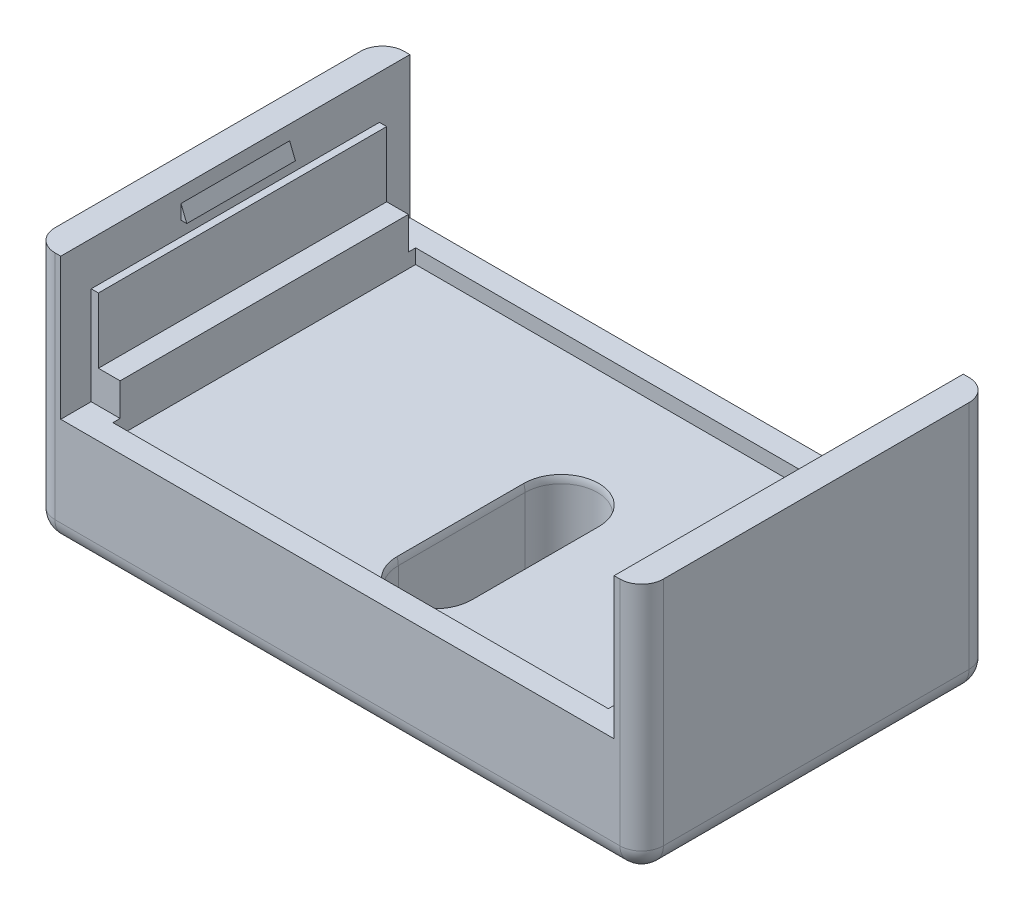
from build123d import *

# Parameters (mm, degrees)
SKETCH2_W               = 84
SKETCH2_H               = 48.2
BOSS_EXTRUDE1_DEPTH     = 3
SKETCH3_W               = 3.8
SKETCH3_H               = 48.2
BOSS_EXTRUDE2_DEPTH     = 19
SKETCH4_W               = 4
SKETCH4_H               = 48.2
BOSS_EXTRUDE3_DEPTH     = 13
BOSS_EXTRUDE4_DEPTH     = 7.5
SKETCH6_W               = 3
SKETCH6_H               = 48.2
CUT_EXTRUDE1_DEPTH      = 9
SKETCH7_W               = 68
SKETCH7_H               = 40.2
CUT_EXTRUDE2_DEPTH      = 0.5
SKETCH9_W               = 84
SKETCH9_H               = 48.2
BOSS_EXTRUDE5_DEPTH     = 15.4
CUT_EXTRUDE3_DEPTH      = 53.202107237
CUT_EXTRUDE3_DEPTH_BACK = 14
CUT_EXTRUDE4_DEPTH      = 53.202107237
CUT_EXTRUDE4_DEPTH_BACK = 53.202107237
FILLET1_R               = 3
SKETCH12_W              = 76.4
SKETCH12_H              = 4.2
CUT_EXTRUDE5_DEPTH      = 20
CUT_EXTRUDE6_DEPTH      = 53.202107283
CUT_EXTRUDE6_DEPTH_BACK = 2
SKETCH13_W              = 68.4
SKETCH13_H              = 41.8


with BuildPart() as part:
    # Sketch2 → Boss-Extrude1 (new body)
    with BuildSketch(Plane(origin=(0, 0, 0), x_dir=(1, 0, 0), z_dir=(0, 1, 0))):
        Rectangle(SKETCH2_W, SKETCH2_H)
    extrude(amount=BOSS_EXTRUDE1_DEPTH)

    # Sketch3 → Boss-Extrude2 (add)
    with BuildSketch(Plane(origin=(0, 3, 0), x_dir=(1, 0, 0), z_dir=(0, 1, 0))):
        with Locations((-40.1, 0)):
            Rectangle(SKETCH3_W, SKETCH3_H)
        with Locations((40.1, 0)):
            Rectangle(SKETCH3_W, SKETCH3_H)
    extrude(amount=BOSS_EXTRUDE2_DEPTH)

    # Sketch4 → Boss-Extrude3 (add)
    with BuildSketch(Plane(origin=(0, 3, 0), x_dir=(1, 0, 0), z_dir=(0, 1, 0))):
        with Locations((-36.2, 0)):
            Rectangle(SKETCH4_W, SKETCH4_H)
        with Locations((36.2, 0)):
            Rectangle(SKETCH4_W, SKETCH4_H)
    extrude(amount=BOSS_EXTRUDE3_DEPTH)

    # Sketch5 → Boss-Extrude4 (add, symmetric)
    with BuildSketch(Plane(origin=(0, 0, 0), x_dir=(-1, 0, 0), z_dir=(0, 0, -1))):
        Polygon((-38.2, 20), (-37.4, 18), (-38.2, 18), align=None)
    boss_extrude4 = extrude(amount=BOSS_EXTRUDE4_DEPTH, both=True)

    # Sketch6 → Cut-Extrude1 (cut)
    with BuildSketch(Plane(origin=(0, 16, 0), x_dir=(1, 0, 0), z_dir=(0, 1, 0))):
        with Locations((35.7, 0)):
            Rectangle(SKETCH6_W, SKETCH6_H)
        with Locations((-35.7, 0)):
            Rectangle(SKETCH6_W, SKETCH6_H)
    extrude(amount=-CUT_EXTRUDE1_DEPTH, mode=Mode.SUBTRACT)

    # Mirror1: Boss-Extrude4 across plane
    add(boss_extrude4.mirror(Plane(origin=(0, 0, 0), x_dir=(0, 0, 1), z_dir=(1, 0, 0))))

    # Sketch7 → Cut-Extrude2 (cut)
    with BuildSketch(Plane(origin=(0, 3, 0), x_dir=(1, 0, 0), z_dir=(0, 1, 0))):
        Rectangle(SKETCH7_W, SKETCH7_H)
    extrude(amount=-CUT_EXTRUDE2_DEPTH, mode=Mode.SUBTRACT)

    # Sketch9 → Boss-Extrude5 (add)
    with BuildSketch(Plane(origin=(0, 2.5, 0), x_dir=(1, 0, 0), z_dir=(0, 1, 0))):
        Rectangle(SKETCH9_W, SKETCH9_H)
    extrude(amount=-BOSS_EXTRUDE5_DEPTH)

    # Sketch10 → Cut-Extrude3 (cut, two sides: drawn at the far end of the back side and taken through both)
    with BuildSketch(Plane(origin=(0, 2.5, 0), x_dir=(1, 0, 0), z_dir=(0, 1, 0)).offset(-CUT_EXTRUDE3_DEPTH_BACK)):
        with BuildLine():
            Line((25.1, 3.7), (25.1, 12.1))
            ThreePointArc((25.1, 12.1), (29.6, 16.6), (34.1, 12.1))
            Line((34.1, 12.1), (34.1, 3.7))
            ThreePointArc((34.1, 3.7), (29.6, -0.8), (25.1, 3.7))
        make_face()
    extrude(amount=CUT_EXTRUDE3_DEPTH + CUT_EXTRUDE3_DEPTH_BACK, mode=Mode.SUBTRACT)

    # Sketch11 → Cut-Extrude4 (cut, two sides: drawn at the far end of the back side and taken through both)
    with BuildSketch(Plane(origin=(0, 2.5, 0), x_dir=(1, 0, 0), z_dir=(0, 1, 0)).offset(-CUT_EXTRUDE4_DEPTH_BACK)):
        with BuildLine():
            Line((9.6, 2.2), (9.6, -15.3))
            ThreePointArc((9.6, -15.3), (4.6, -20.3), (-0.4, -15.3))
            Line((-0.4, -15.3), (-0.4, 2.2))
            ThreePointArc((-0.4, 2.2), (4.6, 7.2), (9.6, 2.2))
        make_face()
    extrude(amount=CUT_EXTRUDE4_DEPTH + CUT_EXTRUDE4_DEPTH_BACK, mode=Mode.SUBTRACT)

    # Fillet1
    # the kernel refuses this fillet: 3 mm, written as the material it takes off along each edge
    with BuildSketch(Plane(origin=(-39, -9.9, 21.1), x_dir=(-1, 0, 0), z_dir=(0, -1, 0))) as fillet1_piece_1_section:
        Polygon((0, 0), (FILLET1_R * 1.02, 0), (FILLET1_R * 1.02, -FILLET1_R * 1.02), (0, -FILLET1_R * 1.02), align=None)
    fillet1_piece_1 = extrude(amount=FILLET1_R * 1.02, mode=Mode.PRIVATE)
    fillet1_piece_1 = fillet1_piece_1 - Plane(origin=(-39, -9.9, 21.1), x_dir=(0.7071067811865475, 0, -0.7071067811865476), z_dir=(0, -1, 0)) * Sphere(FILLET1_R, mode=Mode.PRIVATE)
    add(fillet1_piece_1, mode=Mode.SUBTRACT)
    with BuildSketch(Plane(origin=(-39, -9.9, -21.1), x_dir=(0, -1, 0), z_dir=(0, 0, -1))) as fillet1_piece_2_section:
        Polygon((0, 0), (FILLET1_R * 1.02, 0), (FILLET1_R * 1.02, FILLET1_R * 1.02), (0, FILLET1_R * 1.02), align=None)
    fillet1_piece_2 = extrude(amount=FILLET1_R * 1.02, mode=Mode.PRIVATE)
    fillet1_piece_2 = fillet1_piece_2 - Plane(origin=(-39, -9.9, -21.1), x_dir=(0.7071067811865475, 0.7071067811865475, 0), z_dir=(0, 0, -1)) * Sphere(FILLET1_R, mode=Mode.PRIVATE)
    add(fillet1_piece_2, mode=Mode.SUBTRACT)
    with BuildSketch(Plane(origin=(39, -9.9, -21.1), x_dir=(0, -1, 0), z_dir=(0, 0, -1))) as fillet1_piece_3_section:
        Polygon((0, 0), (FILLET1_R * 1.02, 0), (FILLET1_R * 1.02, -FILLET1_R * 1.02), (0, -FILLET1_R * 1.02), align=None)
    fillet1_piece_3 = extrude(amount=FILLET1_R * 1.02, mode=Mode.PRIVATE)
    fillet1_piece_3 = fillet1_piece_3 - Plane(origin=(39, -9.9, -21.1), x_dir=(-0.7071067811865475, 0.7071067811865475, 0), z_dir=(0, 0, -1)) * Sphere(FILLET1_R, mode=Mode.PRIVATE)
    add(fillet1_piece_3, mode=Mode.SUBTRACT)
    with BuildSketch(Plane(origin=(39, -9.9, 21.1), x_dir=(0, -1, 0), z_dir=(1, 0, 0))) as fillet1_piece_4_section:
        Polygon((0, 0), (FILLET1_R * 1.02, 0), (FILLET1_R * 1.02, -FILLET1_R * 1.02), (0, -FILLET1_R * 1.02), align=None)
    fillet1_piece_4 = extrude(amount=FILLET1_R * 1.02, mode=Mode.PRIVATE)
    fillet1_piece_4 = fillet1_piece_4 - Plane(origin=(39, -9.9, 21.1), x_dir=(0, 0.7071067811865475, -0.7071067811865475), z_dir=(1, 0, 0)) * Sphere(FILLET1_R, mode=Mode.PRIVATE)
    add(fillet1_piece_4, mode=Mode.SUBTRACT)
    with BuildSketch(Plane(origin=(-42, -12.9, 21.1), x_dir=(1, 0, 0), z_dir=(0, 0, -1)), Plane(origin=(42, -12.9, -21.1), x_dir=(-1, 0, 0), z_dir=(0, 0, 1))) as fillet1_piece_5:
        with BuildLine():
            CenterArc((FILLET1_R, -FILLET1_R), FILLET1_R, 90, 90)
            Line((0, -FILLET1_R), (0, 0))
            Line((0, 0), (FILLET1_R, 0))
        make_face()
    extrude(amount=42.2, mode=Mode.SUBTRACT)
    with BuildSketch(Plane(origin=(-39, -12.9, -24.1), x_dir=(0, 1, 0), z_dir=(1, 0, 0))) as fillet1_piece_6:
        with BuildLine():
            CenterArc((FILLET1_R, FILLET1_R), FILLET1_R, 180, 90)
            Line((0, FILLET1_R), (0, 0))
            Line((0, 0), (FILLET1_R, 0))
        make_face()
    extrude(amount=78, mode=Mode.SUBTRACT)
    with BuildSketch(Plane(origin=(39, -12.9, 24.1), x_dir=(0, 0, -1), z_dir=(-1, 0, 0))) as fillet1_piece_7:
        with BuildLine():
            CenterArc((FILLET1_R, -FILLET1_R), FILLET1_R, 90, 90)
            Line((0, -FILLET1_R), (0, 0))
            Line((0, 0), (FILLET1_R, 0))
        make_face()
    extrude(amount=78, mode=Mode.SUBTRACT)
    with BuildSketch(Plane(origin=(25.1, 2.5, -3.7), x_dir=(-1, 0, 0), z_dir=(0, 0, -1))) as fillet1_piece_8:
        with BuildLine():
            CenterArc((FILLET1_R, -FILLET1_R), FILLET1_R, 90, 90)
            Line((0, -FILLET1_R), (0, 0))
            Line((0, 0), (FILLET1_R, 0))
        make_face()
    extrude(amount=8.4, mode=Mode.SUBTRACT)
    with BuildSketch(Plane(origin=(29.6, 2.5, -12.1), x_dir=(-1, 0, 0), z_dir=(0, 0, 1))) as fillet1_piece_9_section:
        with BuildLine():
            CenterArc((4.5 + FILLET1_R, FILLET1_R), FILLET1_R, 180, 90)
            Line((4.5 + FILLET1_R, 0), (4.5, 0))
            Line((4.5, 0), (4.5, FILLET1_R))
        make_face()
    fillet1_piece_9 = revolve(axis=Axis((29.6, 2.5, -12.1), (0, -1, 0)), revolution_arc=263.525069882, mode=Mode.PRIVATE)
    fillet1_piece_9 = split(fillet1_piece_9, bisect_by=Plane(origin=(34, 1.640934382, -17.429209867), z_dir=(-1, 0, 0)), keep=Keep.TOP, mode=Mode.PRIVATE)
    add(fillet1_piece_9, mode=Mode.SUBTRACT)
    with BuildSketch(Plane(origin=(29.6, 2.5, -3.7), x_dir=(0.11276846361504911, 0, -0.9936212928545268), z_dir=(-0.9936212928545268, 0, -0.11276846361504911))) as fillet1_piece_10_section:
        with BuildLine():
            CenterArc((4.5 + FILLET1_R, FILLET1_R), FILLET1_R, 180, 90)
            Line((4.5 + FILLET1_R, 0), (4.5, 0))
            Line((4.5, 0), (4.5, FILLET1_R))
        make_face()
    fillet1_piece_10 = revolve(axis=Axis((29.6, 2.5, -3.7), (0, -1, 0)), revolution_arc=263.525069882, mode=Mode.PRIVATE)
    fillet1_piece_10 = split(fillet1_piece_10, bisect_by=Plane(origin=(34, 1.640934386, 1.629209863), z_dir=(-1, 0, 0)), keep=Keep.TOP, mode=Mode.PRIVATE)
    add(fillet1_piece_10, mode=Mode.SUBTRACT)
    with BuildSketch(Plane(origin=(4.6, 2.5, -2.2), x_dir=(-1, 0, 0), z_dir=(0, 0, 1))) as fillet1_piece_11:
        with BuildLine():
            CenterArc((5 + FILLET1_R, FILLET1_R), FILLET1_R, 180, 90)
            Line((5 + FILLET1_R, 0), (5, 0))
            Line((5, 0), (5, FILLET1_R))
        make_face()
    revolve(axis=Axis((4.6, 2.5, -2.2), (0, -1, 0)), revolution_arc=180, mode=Mode.SUBTRACT)
    with BuildSketch(Plane(origin=(9.6, 2.5, -2.2), x_dir=(0, -1, 0), z_dir=(0, 0, 1)), Plane(origin=(-0.4, 2.5, 15.3), x_dir=(0, -1, 0), z_dir=(0, 0, -1)), Plane(origin=(9.6, -12.9, -2.2), x_dir=(1, 0, 0), z_dir=(0, 0, 1)), Plane(origin=(-0.4, -12.9, 15.3), x_dir=(-1, 0, 0), z_dir=(0, 0, -1))) as fillet1_piece_12:
        with BuildLine():
            CenterArc((FILLET1_R, FILLET1_R), FILLET1_R, 180, 90)
            Line((0, FILLET1_R), (0, 0))
            Line((0, 0), (FILLET1_R, 0))
        make_face()
    extrude(amount=17.5, mode=Mode.SUBTRACT)
    with BuildSketch(Plane(origin=(4.6, 2.5, 15.3), x_dir=(1, 0, 0), z_dir=(0, 0, -1))) as fillet1_piece_13_section:
        with BuildLine():
            CenterArc((5 + FILLET1_R, FILLET1_R), FILLET1_R, 180, 90)
            Line((5 + FILLET1_R, 0), (5, 0))
            Line((5, 0), (5, FILLET1_R))
        make_face()
    fillet1_piece_13 = revolve(axis=Axis((4.6, 2.5, 15.3), (0, -1, 0)), revolution_arc=159.706638681, mode=Mode.PRIVATE)
    fillet1_piece_13 = split(fillet1_piece_13, bisect_by=Plane(origin=(8.507236212, 1.653326519, 20.1), z_dir=(0, 0, -1)), keep=Keep.TOP, mode=Mode.PRIVATE)
    add(fillet1_piece_13, mode=Mode.SUBTRACT)
    with BuildSketch(Plane(origin=(4.6, 2.5, 15.3), x_dir=(0.9379291266520984, 0, 0.3468269790221515), z_dir=(0.3468269790221515, 0, -0.9379291266520984))) as fillet1_piece_14_section:
        with BuildLine():
            CenterArc((5 + FILLET1_R, FILLET1_R), FILLET1_R, 180, 90)
            Line((5 + FILLET1_R, 0), (5, 0))
            Line((5, 0), (5, FILLET1_R))
        make_face()
    fillet1_piece_14 = revolve(axis=Axis((4.6, 2.5, 15.3), (0, -1, 0)), revolution_arc=159.706638681, mode=Mode.PRIVATE)
    fillet1_piece_14 = split(fillet1_piece_14, bisect_by=Plane(origin=(8.773531285, 1.782701888, 20.1), z_dir=(0, 0, -1)), keep=Keep.TOP, mode=Mode.PRIVATE)
    add(fillet1_piece_14, mode=Mode.SUBTRACT)
    with BuildSketch(Plane(origin=(4.6, -12.9, -2.2), x_dir=(-1, 0, 0), z_dir=(0, 0, 1))) as fillet1_piece_15:
        with BuildLine():
            CenterArc((5 + FILLET1_R, -FILLET1_R), FILLET1_R, 90, 90)
            Line((5, -FILLET1_R), (5, 0))
            Line((5, 0), (5 + FILLET1_R, 0))
        make_face()
    revolve(axis=Axis((4.6, -12.9, -2.2), (0, -1, 0)), revolution_arc=180, mode=Mode.SUBTRACT)
    with BuildSketch(Plane(origin=(4.6, -12.9, 15.3), x_dir=(1, 0, 0), z_dir=(0, 0, -1))) as fillet1_piece_16:
        with BuildLine():
            CenterArc((5 + FILLET1_R, -FILLET1_R), FILLET1_R, 90, 90)
            Line((5, -FILLET1_R), (5, 0))
            Line((5, 0), (5 + FILLET1_R, 0))
        make_face()
    revolve(axis=Axis((4.6, -12.9, 15.3), (0, -1, 0)), revolution_arc=180, mode=Mode.SUBTRACT)
    with BuildSketch(Plane(origin=(-42, -9.9, -24.1), x_dir=(1, 0, 0), z_dir=(0, 1, 0)), Plane(origin=(42, 29.5, -24.1), x_dir=(-1, 0, 0), z_dir=(0, -1, 0)), Plane(origin=(42, 29.5, 24.1), x_dir=(0, 0, -1), z_dir=(0, -1, 0)), Plane(origin=(-42, -9.9, 24.1), x_dir=(0, 0, -1), z_dir=(0, 1, 0))) as fillet1_piece_17:
        with BuildLine():
            CenterArc((FILLET1_R, -FILLET1_R), FILLET1_R, 90, 90)
            Line((0, -FILLET1_R), (0, 0))
            Line((0, 0), (FILLET1_R, 0))
        make_face()
    extrude(amount=39.4, mode=Mode.SUBTRACT)

    # Sketch12 → Cut-Extrude5 (cut)
    with BuildSketch(Plane(origin=(0, 2.5, 0), x_dir=(1, 0, 0), z_dir=(0, 1, 0))):
        with Locations((0, 22)):
            Rectangle(SKETCH12_W, SKETCH12_H)
        with Locations((0, -22)):
            Rectangle(SKETCH12_W, SKETCH12_H)
    extrude(amount=CUT_EXTRUDE5_DEPTH, mode=Mode.SUBTRACT)

    # Sketch13 → Cut-Extrude6 (cut, two sides: drawn at the far end of the back side and taken through both)
    with BuildSketch(Plane(origin=(0, 2.5, 0), x_dir=(1, 0, 0), z_dir=(0, 1, 0)).offset(-CUT_EXTRUDE6_DEPTH_BACK)):
        Rectangle(SKETCH13_W, SKETCH13_H)
    extrude(amount=CUT_EXTRUDE6_DEPTH + CUT_EXTRUDE6_DEPTH_BACK, mode=Mode.SUBTRACT)


solid = part.part
